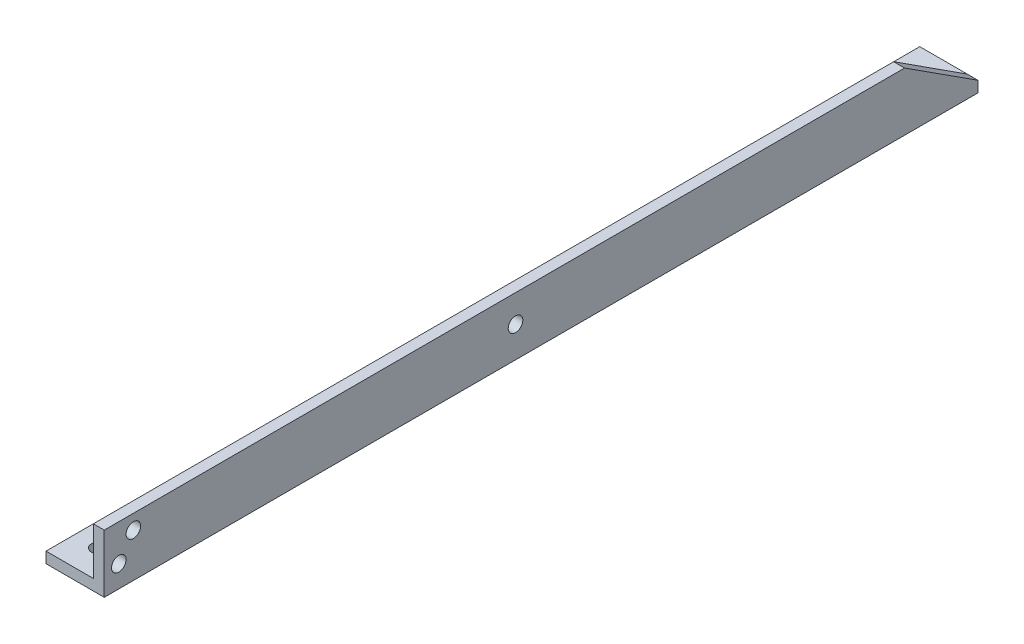
from build123d import *

# Parameters (mm, degrees)
BOSS_EXTRUDE1_DEPTH     = 381
CUT_EXTRUDE2_DEPTH      = 383.403015687
CUT_EXTRUDE2_DEPTH_BACK = 383.403015687
CUT_EXTRUDE3_REACH      = 384.403
SKETCH10_R              = 3.175
CUT_EXTRUDE4_REACH      = 384.69
SKETCH11_R              = 3.175
CUT_EXTRUDE5_REACH      = 384.403
SKETCH12_R              = 3.175


with BuildPart() as part:
    # Sketch1 → Boss-Extrude1 (new body)
    with BuildSketch(Plane.XY):
        Polygon((0, 0), (0, -25.4), (-25.4, -25.4), (-25.4, -20.6375), (-4.7625, -20.6375), (-4.7625, 0), align=None)
    extrude(amount=BOSS_EXTRUDE1_DEPTH)

    # Sketch9 → Cut-Extrude2 (cut, two sides: drawn at the far end of the back side and taken through both)
    with BuildSketch(Plane.ZY.offset(4.7625).offset(-CUT_EXTRUDE2_DEPTH_BACK)):
        Polygon((-649.877066877, -439.409233154), (0, -20.6375), (32.02660759, 0), (681.903674467, 418.771733154), (-155.63979184, 1718.525866908), (-1487.420533185, 860.3449006), align=None)
    extrude(amount=CUT_EXTRUDE2_DEPTH + CUT_EXTRUDE2_DEPTH_BACK, mode=Mode.SUBTRACT)

    # Sketch10 → Cut-Extrude3 (cut, up to next)
    with BuildSketch(Plane.ZY.offset(4.7625), mode=Mode.PRIVATE) as cut_extrude3_sk1:
        with Locations((374.65, -15.875)):
            Circle(SKETCH10_R)
    cut_extrude3_tool1 = extrude(cut_extrude3_sk1.sketch, amount=-CUT_EXTRUDE3_REACH, mode=Mode.PRIVATE) & part.part
    # Sketch10 → Cut-Extrude3 (cut, up to next)
    with BuildSketch(Plane.ZY.offset(4.7625), mode=Mode.PRIVATE) as cut_extrude3_sk2:
        with Locations((368.3, -6.35)):
            Circle(SKETCH10_R)
    cut_extrude3_tool2 = extrude(cut_extrude3_sk2.sketch, amount=-CUT_EXTRUDE3_REACH, mode=Mode.PRIVATE) & part.part
    add(cut_extrude3_tool1.solids().sort_by_distance((-4.7625, -15.875, 374.65))[0], mode=Mode.SUBTRACT)
    add(cut_extrude3_tool2.solids().sort_by_distance((-4.7625, -6.35, 368.3))[0], mode=Mode.SUBTRACT)

    # Sketch11 → Cut-Extrude4 (cut, up to next)
    with BuildSketch(Plane(origin=(0, 0, 0), x_dir=(0, 0, -1), z_dir=(1, 0, 0)), mode=Mode.PRIVATE) as cut_extrude4_sk1:
        with Locations((-201.667249518, -11.929615818)):
            Circle(SKETCH11_R)
    cut_extrude4_tool1 = extrude(cut_extrude4_sk1.sketch, amount=-CUT_EXTRUDE4_REACH, mode=Mode.PRIVATE) & part.part
    add(cut_extrude4_tool1.solids().sort_by_distance((0, -11.929616, 201.66725))[0], mode=Mode.SUBTRACT)

    # Sketch12 → Cut-Extrude5 (cut, up to next)
    with BuildSketch(Plane(origin=(0, -20.6375, 0), x_dir=(1, 0, 0), z_dir=(0, 1, 0)), mode=Mode.PRIVATE) as cut_extrude5_sk1:
        with Locations((-15.08125, -368.3)):
            Circle(SKETCH12_R)
    cut_extrude5_tool1 = extrude(cut_extrude5_sk1.sketch, amount=-CUT_EXTRUDE5_REACH, mode=Mode.PRIVATE) & part.part
    add(cut_extrude5_tool1.solids().sort_by_distance((-15.08125, -20.6375, 368.3))[0], mode=Mode.SUBTRACT)


solid = part.part
